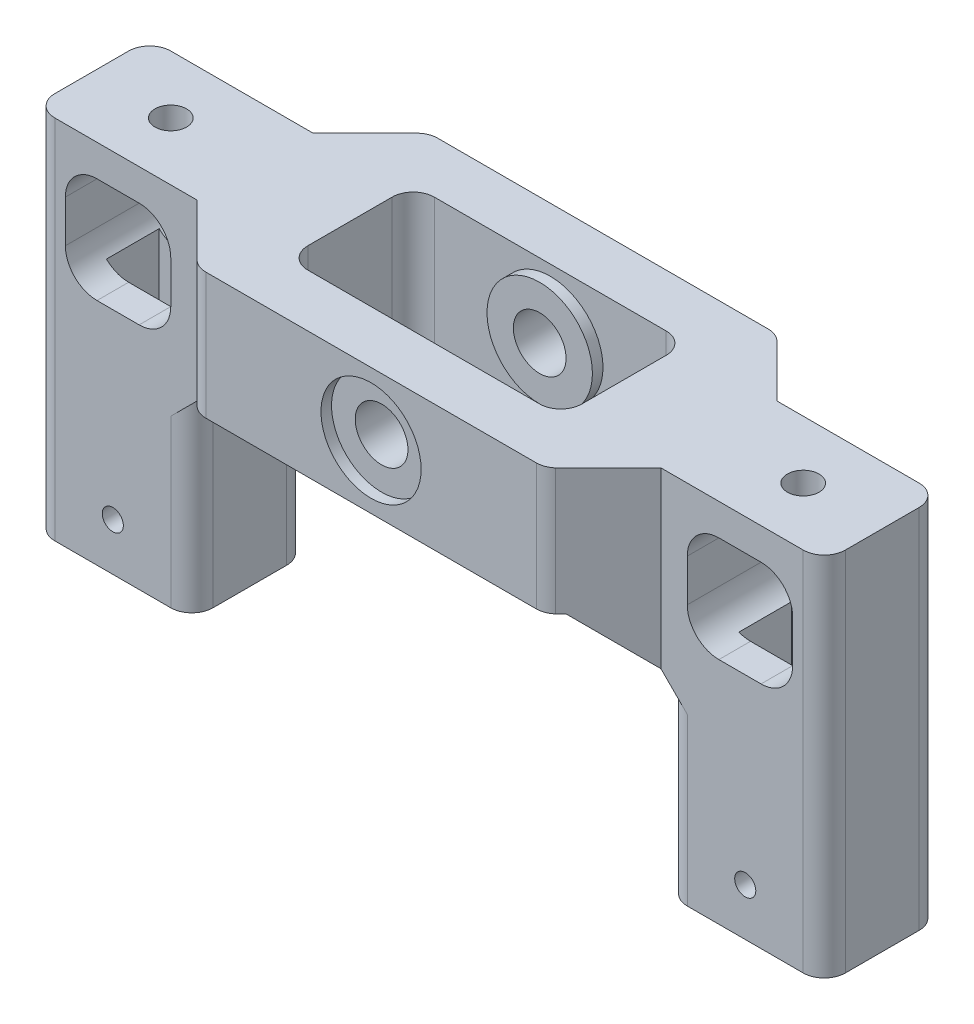
from build123d import *

# Parameters (mm, degrees)
EXTRUDE_1_DEPTH        = 5.5
EXTRUDE_1_DEPTH_BACK   = 5.5
SKETCH_1_W             = 15
SKETCH_1_H             = 24.5
EXTRUDE_1_2_DEPTH      = 5.5
EXTRUDE_1_2_DEPTH_BACK = 5.5
SKETCH_2_W             = 7.2
SKETCH_2_H             = 5
CUT_EXTRUDE_1_DEPTH    = 62
SKETCH_3_W             = 26
SKETCH_3_H             = 12
EXTRUDE_2_DEPTH        = 12
SKETCH_4_R             = 2.5
CUT_EXTRUDE_2_DEPTH    = 90
CHAMFER_2_SIZE         = 5
FILLET_2_R             = 2
SKETCH_14_W            = 15
SKETCH_14_H            = 11
SKETCH_14_W_2          = 7.2
SKETCH_14_H_2          = 5
EXTRUDE_5_DEPTH        = 10.25
SKETCH_7_R             = 1
CUT_EXTRUDE_3_DEPTH    = 34
EXTRUDE_START          = 1
SKETCH_13_R            = 5
SKETCH_13_R_2          = 2.5
EXTRUDE_4_DEPTH        = 1
CHAMFER_3_SIZE         = 5
SKETCH_19_W            = 10
SKETCH_19_H            = 10
CUT_EXTRUDE_4_DEPTH    = 31.2
SKETCH_17_R            = 4.75
SKETCH_17_R_2          = 2.5
CUT_EXTRUDE_5_DEPTH    = 1
SKETCH_20_W            = 7.2
SKETCH_20_H            = 3
EXTRUDE_6_DEPTH        = 5
FILLET_6_R             = 3
FILLET_7_R             = 2
SKETCH_23_R            = 1.5
CUT_EXTRUDE_6_DEPTH    = 3


with BuildPart() as part:
    # 草图1 → 凸台-拉伸1 (new, two sides: drawn at the far end of the back side and taken through both)
    with BuildSketch(Plane.XY.offset(-EXTRUDE_1_DEPTH_BACK)):
        with Locations((30, 0)):
            Rectangle(SKETCH_1_W, SKETCH_1_H)
    extrude(amount=EXTRUDE_1_DEPTH + EXTRUDE_1_DEPTH_BACK)


with BuildPart() as body_2:
    # 草图1 → Extrude 1 2 (new, two sides: drawn at the far end of the back side and taken through both)
    with BuildSketch(Plane.XY.offset(-EXTRUDE_1_2_DEPTH_BACK)):
        with Locations((-30, 0)):
            Rectangle(SKETCH_1_W, SKETCH_1_H)
    extrude(amount=EXTRUDE_1_2_DEPTH + EXTRUDE_1_2_DEPTH_BACK)


with BuildPart() as cut_extrude_1_tool:
    # 草图2 → 切除-拉伸1 (new body)
    with BuildSketch(Plane(origin=(0, 12.25, 0), x_dir=(1, 0, 0), z_dir=(0, 1, 0))):
        with Locations((30, 0)):
            Rectangle(SKETCH_2_W, SKETCH_2_H)
        with Locations((-30, 0)):
            Rectangle(SKETCH_2_W, SKETCH_2_H)
    extrude(amount=-CUT_EXTRUDE_1_DEPTH)


with BuildPart() as part_1:
    add(part.part)

    # 切除-拉伸1: cut by cut_extrude_1_tool
    add(cut_extrude_1_tool.part, mode=Mode.SUBTRACT)



with BuildPart() as body_2_1:
    add(body_2.part)

    # 切除-拉伸1: cut by cut_extrude_1_tool
    add(cut_extrude_1_tool.part, mode=Mode.SUBTRACT)


with BuildPart() as part_2:
    add(part_1.part)

    add(body_2_1.part)  # 凸台-拉伸2 merges body 2
    # 草图3 → 凸台-拉伸2 (add)
    with BuildSketch(Plane(origin=(0, 12.25, 0), x_dir=(1, 0, 0), z_dir=(0, 1, 0))):
        Polygon((22.5, 5.5), (17, 5.5), (17, 11), (-17, 11), (-17, 5.5), (-22.5, 5.5), (-22.5, -5.5), (-17, -5.5), (-17, -11), (17, -11), (17, -5.5), (22.5, -5.5), align=None)
        Rectangle(SKETCH_3_W, SKETCH_3_H, mode=Mode.SUBTRACT)
    extrude(amount=-EXTRUDE_2_DEPTH)

    # 草图4 → 切除-拉伸2 (cut)
    with BuildSketch(Plane.XY.offset(11)):
        with Locations((0, 6.25)):
            Circle(SKETCH_4_R)
    extrude(amount=-CUT_EXTRUDE_2_DEPTH, mode=Mode.SUBTRACT)

    # 倒角2
    chamfer_2_edges = [part_2.edges().sort_by_distance(p)[0] for p in [
        (17, 6.25, 5.5),
        (-17, 6.25, 5.5),
        (-17, 6.25, -5.5),
        (17, 6.25, -5.5),
    ]]
    chamfer(chamfer_2_edges, length=CHAMFER_2_SIZE)

    # 圆角2
    # the kernel refuses this fillet: 2 mm, written as the material it adds along each edge
    with BuildSketch(Plane(origin=(-13, 12.25, 6), x_dir=(0, 0, -1), z_dir=(0, -1, 0)), Plane(origin=(13, 12.25, 6), x_dir=(-1, 0, 0), z_dir=(0, -1, 0)), Plane(origin=(13, 12.25, -6), x_dir=(0, 0, 1), z_dir=(0, -1, 0))) as fillet_2_piece_1:
        with BuildLine():
            CenterArc((FILLET_2_R, FILLET_2_R), FILLET_2_R, 180, 90)
            Line((0, FILLET_2_R), (0, 0))
            Line((0, 0), (FILLET_2_R, 0))
        make_face()
    extrude(amount=12)
    with BuildSketch(Plane(origin=(-13, 12.25, -6), x_dir=(0, 0, 1), z_dir=(0, -1, 0))) as fillet_2_piece_2:
        with BuildLine():
            CenterArc((FILLET_2_R, -FILLET_2_R), FILLET_2_R, 90, 90)
            Line((0, -FILLET_2_R), (0, 0))
            Line((0, 0), (FILLET_2_R, 0))
        make_face()
    extrude(amount=12)
    # the kernel refuses this fillet: 2 mm, written as the material it takes off along each edge
    with BuildSketch(Plane(origin=(17, 15.557189139, 11), x_dir=(0, 0, -1), z_dir=(0, -1, 0))) as fillet_2_2_piece_1:
        with BuildLine():
            CenterArc((2, -1.322875656), FILLET_2_R, 138.590377891, 41.409622109)
            Line((0, -1.322875656), (0, 0))
            Line((0, 0), (0.5, 0))
        make_face()
    extrude(amount=18.614378278, mode=Mode.SUBTRACT)
    with BuildSketch(Plane(origin=(-17, 15.557189139, 11), x_dir=(1, 0, 0), z_dir=(0, -1, 0))) as fillet_2_2_piece_2:
        with BuildLine():
            CenterArc((1.322875656, -2), FILLET_2_R, 90, 41.409622109)
            Line((0, -0.5), (0, 0))
            Line((0, 0), (1.322875656, 0))
        make_face()
    extrude(amount=18.614378278, mode=Mode.SUBTRACT)
    with BuildSketch(Plane(origin=(-17, 15.557189139, -11), x_dir=(1, 0, 0), z_dir=(0, -1, 0))) as fillet_2_2_piece_3:
        with BuildLine():
            CenterArc((1.322875656, 2), FILLET_2_R, 228.590377891, 41.409622109)
            Line((0, 0.5), (0, 0))
            Line((0, 0), (1.322875656, 0))
        make_face()
    extrude(amount=18.614378278, mode=Mode.SUBTRACT)
    with BuildSketch(Plane(origin=(17, 15.557189139, -11), x_dir=(0, 0, 1), z_dir=(0, -1, 0))) as fillet_2_2_piece_4:
        with BuildLine():
            CenterArc((2, 1.322875656), FILLET_2_R, 180, 41.409622109)
            Line((0, 1.322875656), (0, 0))
            Line((0, 0), (0.5, 0))
        make_face()
    extrude(amount=18.614378278, mode=Mode.SUBTRACT)

    # 草图14 → 凸台-拉伸5 (add)
    # profile 1 of 2: a face of its own
    with BuildSketch(Plane.XZ.offset(12.25)):
        with Locations((-30, 0)):
            Rectangle(SKETCH_14_W, SKETCH_14_H)
        with Locations((-30, 0)):
            Rectangle(SKETCH_14_W_2, SKETCH_14_H_2, mode=Mode.SUBTRACT)
    # profile 2 of 2: a face of its own
    with BuildSketch(Plane.XZ.offset(12.25)):
        with Locations((30, 0)):
            Rectangle(SKETCH_14_W, SKETCH_14_H)
        with Locations((30, 0)):
            Rectangle(SKETCH_14_W_2, SKETCH_14_H_2, mode=Mode.SUBTRACT)
    extrude(amount=EXTRUDE_5_DEPTH)

    # 草图7 → 切除-拉伸3 (cut)
    with BuildSketch(Plane.XY.offset(5.5)):
        with Locations(Location((30, -18, 0), (0, 0, 180))):
            Circle(SKETCH_7_R)
        with Locations(Location((-30, -18, 0), (0, 0, 180))):
            Circle(SKETCH_7_R)
    extrude(amount=-CUT_EXTRUDE_3_DEPTH, mode=Mode.SUBTRACT)

    # 草图13 → 凸台-拉伸4 (add)
    with BuildSketch(Plane.XY.offset(-6).offset(EXTRUDE_START)):
        with Locations(Location((0, 6.25, 0), (0, 0, 180))):
            Circle(SKETCH_13_R)
        with Locations((0, 6.25)):
            Circle(SKETCH_13_R_2, mode=Mode.SUBTRACT)
    extrude_4 = extrude(amount=-EXTRUDE_4_DEPTH)

    # 镜向1: 凸台-拉伸4 across plane
    add(extrude_4.mirror(Plane.XY))

    # 倒角3
    chamfer_3_edges = [part_2.edges().sort_by_distance(p)[0] for p in [
        (22.5, 0.25, 0),
        (-22.5, 0.25, 0),
    ]]
    chamfer(chamfer_3_edges, length=CHAMFER_3_SIZE)

    # 草图19 → 切除-拉伸4 (cut)
    with BuildSketch(Plane.XY.offset(5.5)):
        with Locations((-29.5, 4.25)):
            Rectangle(SKETCH_19_W, SKETCH_19_H)
        with Locations((29.5, 4.25)):
            Rectangle(SKETCH_19_W, SKETCH_19_H)
    extrude(amount=-CUT_EXTRUDE_4_DEPTH, mode=Mode.SUBTRACT)

    # 草图17 → 切除-拉伸5 (cut)
    with BuildSketch(Plane.XY.offset(11)):
        with Locations((0, 6.25)):
            Circle(SKETCH_17_R)
        with Locations((0, 6.25)):
            Circle(SKETCH_17_R_2, mode=Mode.SUBTRACT)
    cut_extrude_5 = extrude(amount=-CUT_EXTRUDE_5_DEPTH, mode=Mode.SUBTRACT)

    # 镜向2: 切除-拉伸5 across plane
    add(cut_extrude_5.mirror(Plane.XY), mode=Mode.SUBTRACT)

    # 草图20 → 凸台-拉伸6 (add)
    with BuildSketch(Plane.XY.offset(-2.5)):
        with Locations((-30, 10.75)):
            Rectangle(SKETCH_20_W, SKETCH_20_H)
        with Locations((30, 10.75)):
            Rectangle(SKETCH_20_W, SKETCH_20_H)
    extrude(amount=EXTRUDE_6_DEPTH)

    # 圆角6
    # the kernel refuses this fillet: 3 mm, written as the material it adds along each edge
    with BuildSketch(Plane(origin=(24.5, -0.75, 5.5), x_dir=(0, 1, 0), z_dir=(0, 0, -1))) as fillet_6_piece_1_section:
        with BuildLine():
            CenterArc((FILLET_6_R, FILLET_6_R), FILLET_6_R, 180, 90)
            Line((0, FILLET_6_R), (0, 0))
            Line((0, 0), (FILLET_6_R, 0))
        make_face()
    fillet_6_piece_1 = extrude(amount=11, mode=Mode.PRIVATE)
    fillet_6_piece_1 = split(fillet_6_piece_1, bisect_by=Plane(origin=(24.5, -0.75, 2.5), z_dir=(0, 0, 1)), keep=Keep.TOP, mode=Mode.PRIVATE)
    fillet_6_piece_1 = split(fillet_6_piece_1, bisect_by=Plane(origin=(26.4, -0.75, 5.5), z_dir=(-1, 0, 0)), keep=Keep.TOP, mode=Mode.PRIVATE)
    add(fillet_6_piece_1)
    with BuildSketch(Plane(origin=(24.5, -0.75, 5.5), x_dir=(0, 1, 0), z_dir=(0, 0, -1))) as fillet_6_piece_2_section:
        with BuildLine():
            CenterArc((FILLET_6_R, FILLET_6_R), FILLET_6_R, 180, 90)
            Line((0, FILLET_6_R), (0, 0))
            Line((0, 0), (FILLET_6_R, 0))
        make_face()
    fillet_6_piece_2 = extrude(amount=11, mode=Mode.PRIVATE)
    fillet_6_piece_2 = split(fillet_6_piece_2, bisect_by=Plane(origin=(24.5, -0.75, 2.5), z_dir=(0, 0, 1)), keep=Keep.TOP, mode=Mode.PRIVATE)
    fillet_6_piece_2 = split(fillet_6_piece_2, bisect_by=Plane(origin=(26.4, -0.75, 5.5), z_dir=(1, 0, 0)), keep=Keep.TOP, mode=Mode.PRIVATE)
    add(fillet_6_piece_2)
    with BuildSketch(Plane(origin=(24.5, -0.75, 5.5), x_dir=(0, 1, 0), z_dir=(0, 0, -1))) as fillet_6_piece_3_section:
        with BuildLine():
            CenterArc((FILLET_6_R, FILLET_6_R), FILLET_6_R, 180, 90)
            Line((0, FILLET_6_R), (0, 0))
            Line((0, 0), (FILLET_6_R, 0))
        make_face()
    fillet_6_piece_3 = extrude(amount=11, mode=Mode.PRIVATE)
    fillet_6_piece_3 = split(fillet_6_piece_3, bisect_by=Plane(origin=(24.5, -0.75, -2.5), z_dir=(0, 0, 1)), keep=Keep.TOP, mode=Mode.PRIVATE)
    fillet_6_piece_3 = split(fillet_6_piece_3, bisect_by=Plane(origin=(24.5, -0.75, 2.5), z_dir=(0, 0, -1)), keep=Keep.TOP, mode=Mode.PRIVATE)
    fillet_6_piece_3 = split(fillet_6_piece_3, bisect_by=Plane(origin=(26.4, -0.75, 5.5), z_dir=(-1, 0, 0)), keep=Keep.TOP, mode=Mode.PRIVATE)
    add(fillet_6_piece_3)
    with BuildSketch(Plane(origin=(24.5, -0.75, 5.5), x_dir=(0, 1, 0), z_dir=(0, 0, -1))) as fillet_6_piece_4_section:
        with BuildLine():
            CenterArc((FILLET_6_R, FILLET_6_R), FILLET_6_R, 180, 90)
            Line((0, FILLET_6_R), (0, 0))
            Line((0, 0), (FILLET_6_R, 0))
        make_face()
    fillet_6_piece_4 = extrude(amount=11, mode=Mode.PRIVATE)
    fillet_6_piece_4 = split(fillet_6_piece_4, bisect_by=Plane(origin=(24.5, -0.75, -2.5), z_dir=(0, 0, -1)), keep=Keep.TOP, mode=Mode.PRIVATE)
    fillet_6_piece_4 = split(fillet_6_piece_4, bisect_by=Plane(origin=(26.4, -0.75, 5.5), z_dir=(-1, 0, 0)), keep=Keep.TOP, mode=Mode.PRIVATE)
    add(fillet_6_piece_4)
    with BuildSketch(Plane(origin=(24.5, -0.75, 5.5), x_dir=(0, 1, 0), z_dir=(0, 0, -1))) as fillet_6_piece_5_section:
        with BuildLine():
            CenterArc((FILLET_6_R, FILLET_6_R), FILLET_6_R, 180, 90)
            Line((0, FILLET_6_R), (0, 0))
            Line((0, 0), (FILLET_6_R, 0))
        make_face()
    fillet_6_piece_5 = extrude(amount=11, mode=Mode.PRIVATE)
    fillet_6_piece_5 = split(fillet_6_piece_5, bisect_by=Plane(origin=(24.5, -0.75, -2.5), z_dir=(0, 0, -1)), keep=Keep.TOP, mode=Mode.PRIVATE)
    fillet_6_piece_5 = split(fillet_6_piece_5, bisect_by=Plane(origin=(26.4, -0.75, 5.5), z_dir=(1, 0, 0)), keep=Keep.TOP, mode=Mode.PRIVATE)
    add(fillet_6_piece_5)
    with BuildSketch(Plane(origin=(-24.5, -0.75, 5.5), x_dir=(-1, 0, 0), z_dir=(0, 0, -1))) as fillet_6_piece_6_section:
        with BuildLine():
            CenterArc((FILLET_6_R, FILLET_6_R), FILLET_6_R, 180, 90)
            Line((0, FILLET_6_R), (0, 0))
            Line((0, 0), (FILLET_6_R, 0))
        make_face()
    fillet_6_piece_6 = extrude(amount=11, mode=Mode.PRIVATE)
    fillet_6_piece_6 = split(fillet_6_piece_6, bisect_by=Plane(origin=(-24.5, -0.75, 2.5), z_dir=(0, 0, 1)), keep=Keep.TOP, mode=Mode.PRIVATE)
    fillet_6_piece_6 = split(fillet_6_piece_6, bisect_by=Plane(origin=(-26.4, -0.75, 5.5), z_dir=(-1, 0, 0)), keep=Keep.TOP, mode=Mode.PRIVATE)
    add(fillet_6_piece_6)
    with BuildSketch(Plane(origin=(-24.5, -0.75, 5.5), x_dir=(-1, 0, 0), z_dir=(0, 0, -1))) as fillet_6_piece_7_section:
        with BuildLine():
            CenterArc((FILLET_6_R, FILLET_6_R), FILLET_6_R, 180, 90)
            Line((0, FILLET_6_R), (0, 0))
            Line((0, 0), (FILLET_6_R, 0))
        make_face()
    fillet_6_piece_7 = extrude(amount=11, mode=Mode.PRIVATE)
    fillet_6_piece_7 = split(fillet_6_piece_7, bisect_by=Plane(origin=(-24.5, -0.75, 2.5), z_dir=(0, 0, 1)), keep=Keep.TOP, mode=Mode.PRIVATE)
    fillet_6_piece_7 = split(fillet_6_piece_7, bisect_by=Plane(origin=(-26.4, -0.75, 5.5), z_dir=(1, 0, 0)), keep=Keep.TOP, mode=Mode.PRIVATE)
    add(fillet_6_piece_7)
    with BuildSketch(Plane(origin=(-24.5, -0.75, 5.5), x_dir=(-1, 0, 0), z_dir=(0, 0, -1))) as fillet_6_piece_8_section:
        with BuildLine():
            CenterArc((FILLET_6_R, FILLET_6_R), FILLET_6_R, 180, 90)
            Line((0, FILLET_6_R), (0, 0))
            Line((0, 0), (FILLET_6_R, 0))
        make_face()
    fillet_6_piece_8 = extrude(amount=11, mode=Mode.PRIVATE)
    fillet_6_piece_8 = split(fillet_6_piece_8, bisect_by=Plane(origin=(-24.5, -0.75, 2.5), z_dir=(0, 0, -1)), keep=Keep.TOP, mode=Mode.PRIVATE)
    fillet_6_piece_8 = split(fillet_6_piece_8, bisect_by=Plane(origin=(-24.5, -0.75, -2.5), z_dir=(0, 0, 1)), keep=Keep.TOP, mode=Mode.PRIVATE)
    fillet_6_piece_8 = split(fillet_6_piece_8, bisect_by=Plane(origin=(-26.4, -0.75, 5.5), z_dir=(1, 0, 0)), keep=Keep.TOP, mode=Mode.PRIVATE)
    add(fillet_6_piece_8)
    with BuildSketch(Plane(origin=(-24.5, -0.75, 5.5), x_dir=(-1, 0, 0), z_dir=(0, 0, -1))) as fillet_6_piece_9_section:
        with BuildLine():
            CenterArc((FILLET_6_R, FILLET_6_R), FILLET_6_R, 180, 90)
            Line((0, FILLET_6_R), (0, 0))
            Line((0, 0), (FILLET_6_R, 0))
        make_face()
    fillet_6_piece_9 = extrude(amount=11, mode=Mode.PRIVATE)
    fillet_6_piece_9 = split(fillet_6_piece_9, bisect_by=Plane(origin=(-24.5, -0.75, -2.5), z_dir=(0, 0, -1)), keep=Keep.TOP, mode=Mode.PRIVATE)
    fillet_6_piece_9 = split(fillet_6_piece_9, bisect_by=Plane(origin=(-26.4, -0.75, 5.5), z_dir=(-1, 0, 0)), keep=Keep.TOP, mode=Mode.PRIVATE)
    add(fillet_6_piece_9)
    with BuildSketch(Plane(origin=(-24.5, -0.75, 5.5), x_dir=(-1, 0, 0), z_dir=(0, 0, -1))) as fillet_6_piece_10_section:
        with BuildLine():
            CenterArc((FILLET_6_R, FILLET_6_R), FILLET_6_R, 180, 90)
            Line((0, FILLET_6_R), (0, 0))
            Line((0, 0), (FILLET_6_R, 0))
        make_face()
    fillet_6_piece_10 = extrude(amount=11, mode=Mode.PRIVATE)
    fillet_6_piece_10 = split(fillet_6_piece_10, bisect_by=Plane(origin=(-24.5, -0.75, -2.5), z_dir=(0, 0, -1)), keep=Keep.TOP, mode=Mode.PRIVATE)
    fillet_6_piece_10 = split(fillet_6_piece_10, bisect_by=Plane(origin=(-26.4, -0.75, 5.5), z_dir=(1, 0, 0)), keep=Keep.TOP, mode=Mode.PRIVATE)
    add(fillet_6_piece_10)
    with BuildSketch(Plane(origin=(34.5, -0.75, 5.5), x_dir=(-1, 0, 0), z_dir=(0, 0, -1))) as fillet_6_piece_11_section:
        with BuildLine():
            CenterArc((FILLET_6_R, FILLET_6_R), FILLET_6_R, 180, 90)
            Line((0, FILLET_6_R), (0, 0))
            Line((0, 0), (FILLET_6_R, 0))
        make_face()
    fillet_6_piece_11 = extrude(amount=11, mode=Mode.PRIVATE)
    fillet_6_piece_11 = split(fillet_6_piece_11, bisect_by=Plane(origin=(33.6, -0.75, 5.5), z_dir=(-1, 0, 0)), keep=Keep.TOP, mode=Mode.PRIVATE)
    fillet_6_piece_11 = split(fillet_6_piece_11, bisect_by=Plane(origin=(34.5, -0.75, 2.5), z_dir=(0, 0, 1)), keep=Keep.TOP, mode=Mode.PRIVATE)
    add(fillet_6_piece_11)
    with BuildSketch(Plane(origin=(34.5, -0.75, 5.5), x_dir=(-1, 0, 0), z_dir=(0, 0, -1))) as fillet_6_piece_12_section:
        with BuildLine():
            CenterArc((FILLET_6_R, FILLET_6_R), FILLET_6_R, 180, 90)
            Line((0, FILLET_6_R), (0, 0))
            Line((0, 0), (FILLET_6_R, 0))
        make_face()
    fillet_6_piece_12 = extrude(amount=11, mode=Mode.PRIVATE)
    fillet_6_piece_12 = split(fillet_6_piece_12, bisect_by=Plane(origin=(33.6, -0.75, 5.5), z_dir=(1, 0, 0)), keep=Keep.TOP, mode=Mode.PRIVATE)
    fillet_6_piece_12 = split(fillet_6_piece_12, bisect_by=Plane(origin=(34.5, -0.75, 2.5), z_dir=(0, 0, 1)), keep=Keep.TOP, mode=Mode.PRIVATE)
    add(fillet_6_piece_12)
    with BuildSketch(Plane(origin=(34.5, -0.75, 5.5), x_dir=(-1, 0, 0), z_dir=(0, 0, -1))) as fillet_6_piece_13_section:
        with BuildLine():
            CenterArc((FILLET_6_R, FILLET_6_R), FILLET_6_R, 180, 90)
            Line((0, FILLET_6_R), (0, 0))
            Line((0, 0), (FILLET_6_R, 0))
        make_face()
    fillet_6_piece_13 = extrude(amount=11, mode=Mode.PRIVATE)
    fillet_6_piece_13 = split(fillet_6_piece_13, bisect_by=Plane(origin=(34.5, -0.75, -2.5), z_dir=(0, 0, 1)), keep=Keep.TOP, mode=Mode.PRIVATE)
    fillet_6_piece_13 = split(fillet_6_piece_13, bisect_by=Plane(origin=(33.6, -0.75, 5.5), z_dir=(1, 0, 0)), keep=Keep.TOP, mode=Mode.PRIVATE)
    fillet_6_piece_13 = split(fillet_6_piece_13, bisect_by=Plane(origin=(34.5, -0.75, 2.5), z_dir=(0, 0, -1)), keep=Keep.TOP, mode=Mode.PRIVATE)
    add(fillet_6_piece_13)
    with BuildSketch(Plane(origin=(34.5, -0.75, 5.5), x_dir=(-1, 0, 0), z_dir=(0, 0, -1))) as fillet_6_piece_14_section:
        with BuildLine():
            CenterArc((FILLET_6_R, FILLET_6_R), FILLET_6_R, 180, 90)
            Line((0, FILLET_6_R), (0, 0))
            Line((0, 0), (FILLET_6_R, 0))
        make_face()
    fillet_6_piece_14 = extrude(amount=11, mode=Mode.PRIVATE)
    fillet_6_piece_14 = split(fillet_6_piece_14, bisect_by=Plane(origin=(34.5, -0.75, -2.5), z_dir=(0, 0, -1)), keep=Keep.TOP, mode=Mode.PRIVATE)
    fillet_6_piece_14 = split(fillet_6_piece_14, bisect_by=Plane(origin=(33.6, -0.75, 5.5), z_dir=(-1, 0, 0)), keep=Keep.TOP, mode=Mode.PRIVATE)
    add(fillet_6_piece_14)
    with BuildSketch(Plane(origin=(34.5, -0.75, 5.5), x_dir=(-1, 0, 0), z_dir=(0, 0, -1))) as fillet_6_piece_15_section:
        with BuildLine():
            CenterArc((FILLET_6_R, FILLET_6_R), FILLET_6_R, 180, 90)
            Line((0, FILLET_6_R), (0, 0))
            Line((0, 0), (FILLET_6_R, 0))
        make_face()
    fillet_6_piece_15 = extrude(amount=11, mode=Mode.PRIVATE)
    fillet_6_piece_15 = split(fillet_6_piece_15, bisect_by=Plane(origin=(34.5, -0.75, -2.5), z_dir=(0, 0, -1)), keep=Keep.TOP, mode=Mode.PRIVATE)
    fillet_6_piece_15 = split(fillet_6_piece_15, bisect_by=Plane(origin=(33.6, -0.75, 5.5), z_dir=(1, 0, 0)), keep=Keep.TOP, mode=Mode.PRIVATE)
    add(fillet_6_piece_15)
    with BuildSketch(Plane(origin=(24.5, 9.25, 5.5), x_dir=(1, 0, 0), z_dir=(0, 0, -1)), Plane(origin=(-24.5, 9.25, 5.5), x_dir=(0, -1, 0), z_dir=(0, 0, -1)), Plane(origin=(-34.5, 9.25, 5.5), x_dir=(1, 0, 0), z_dir=(0, 0, -1))) as fillet_6_piece_16:
        with BuildLine():
            CenterArc((FILLET_6_R, FILLET_6_R), FILLET_6_R, 180, 90)
            Line((0, FILLET_6_R), (0, 0))
            Line((0, 0), (FILLET_6_R, 0))
        make_face()
    extrude(amount=11)
    with BuildSketch(Plane(origin=(34.5, 9.25, 5.5), x_dir=(-1, 0, 0), z_dir=(0, 0, -1))) as fillet_6_piece_17:
        with BuildLine():
            CenterArc((FILLET_6_R, -FILLET_6_R), FILLET_6_R, 90, 90)
            Line((0, -FILLET_6_R), (0, 0))
            Line((0, 0), (FILLET_6_R, 0))
        make_face()
    extrude(amount=11)
    with BuildSketch(Plane(origin=(-34.5, -0.75, 5.5), x_dir=(1, 0, 0), z_dir=(0, 0, -1))) as fillet_6_piece_18_section:
        with BuildLine():
            CenterArc((FILLET_6_R, -FILLET_6_R), FILLET_6_R, 90, 90)
            Line((0, -FILLET_6_R), (0, 0))
            Line((0, 0), (FILLET_6_R, 0))
        make_face()
    fillet_6_piece_18 = extrude(amount=11, mode=Mode.PRIVATE)
    fillet_6_piece_18 = split(fillet_6_piece_18, bisect_by=Plane(origin=(-34.5, -0.75, 2.5), z_dir=(0, 0, 1)), keep=Keep.TOP, mode=Mode.PRIVATE)
    fillet_6_piece_18 = split(fillet_6_piece_18, bisect_by=Plane(origin=(-33.6, -0.75, 5.5), z_dir=(1, 0, 0)), keep=Keep.TOP, mode=Mode.PRIVATE)
    add(fillet_6_piece_18)
    with BuildSketch(Plane(origin=(-34.5, -0.75, 5.5), x_dir=(1, 0, 0), z_dir=(0, 0, -1))) as fillet_6_piece_19_section:
        with BuildLine():
            CenterArc((FILLET_6_R, -FILLET_6_R), FILLET_6_R, 90, 90)
            Line((0, -FILLET_6_R), (0, 0))
            Line((0, 0), (FILLET_6_R, 0))
        make_face()
    fillet_6_piece_19 = extrude(amount=11, mode=Mode.PRIVATE)
    fillet_6_piece_19 = split(fillet_6_piece_19, bisect_by=Plane(origin=(-34.5, -0.75, 2.5), z_dir=(0, 0, 1)), keep=Keep.TOP, mode=Mode.PRIVATE)
    fillet_6_piece_19 = split(fillet_6_piece_19, bisect_by=Plane(origin=(-33.6, -0.75, 5.5), z_dir=(-1, 0, 0)), keep=Keep.TOP, mode=Mode.PRIVATE)
    add(fillet_6_piece_19)
    with BuildSketch(Plane(origin=(-34.5, -0.75, 5.5), x_dir=(1, 0, 0), z_dir=(0, 0, -1))) as fillet_6_piece_20_section:
        with BuildLine():
            CenterArc((FILLET_6_R, -FILLET_6_R), FILLET_6_R, 90, 90)
            Line((0, -FILLET_6_R), (0, 0))
            Line((0, 0), (FILLET_6_R, 0))
        make_face()
    fillet_6_piece_20 = extrude(amount=11, mode=Mode.PRIVATE)
    fillet_6_piece_20 = split(fillet_6_piece_20, bisect_by=Plane(origin=(-34.5, -0.75, 2.5), z_dir=(0, 0, -1)), keep=Keep.TOP, mode=Mode.PRIVATE)
    fillet_6_piece_20 = split(fillet_6_piece_20, bisect_by=Plane(origin=(-33.6, -0.75, 5.5), z_dir=(-1, 0, 0)), keep=Keep.TOP, mode=Mode.PRIVATE)
    fillet_6_piece_20 = split(fillet_6_piece_20, bisect_by=Plane(origin=(-34.5, -0.75, -2.5), z_dir=(0, 0, 1)), keep=Keep.TOP, mode=Mode.PRIVATE)
    add(fillet_6_piece_20)
    with BuildSketch(Plane(origin=(-34.5, -0.75, 5.5), x_dir=(1, 0, 0), z_dir=(0, 0, -1))) as fillet_6_piece_21_section:
        with BuildLine():
            CenterArc((FILLET_6_R, -FILLET_6_R), FILLET_6_R, 90, 90)
            Line((0, -FILLET_6_R), (0, 0))
            Line((0, 0), (FILLET_6_R, 0))
        make_face()
    fillet_6_piece_21 = extrude(amount=11, mode=Mode.PRIVATE)
    fillet_6_piece_21 = split(fillet_6_piece_21, bisect_by=Plane(origin=(-33.6, -0.75, 5.5), z_dir=(1, 0, 0)), keep=Keep.TOP, mode=Mode.PRIVATE)
    fillet_6_piece_21 = split(fillet_6_piece_21, bisect_by=Plane(origin=(-34.5, -0.75, -2.5), z_dir=(0, 0, -1)), keep=Keep.TOP, mode=Mode.PRIVATE)
    add(fillet_6_piece_21)
    with BuildSketch(Plane(origin=(-34.5, -0.75, 5.5), x_dir=(1, 0, 0), z_dir=(0, 0, -1))) as fillet_6_piece_22_section:
        with BuildLine():
            CenterArc((FILLET_6_R, -FILLET_6_R), FILLET_6_R, 90, 90)
            Line((0, -FILLET_6_R), (0, 0))
            Line((0, 0), (FILLET_6_R, 0))
        make_face()
    fillet_6_piece_22 = extrude(amount=11, mode=Mode.PRIVATE)
    fillet_6_piece_22 = split(fillet_6_piece_22, bisect_by=Plane(origin=(-33.6, -0.75, 5.5), z_dir=(-1, 0, 0)), keep=Keep.TOP, mode=Mode.PRIVATE)
    fillet_6_piece_22 = split(fillet_6_piece_22, bisect_by=Plane(origin=(-34.5, -0.75, -2.5), z_dir=(0, 0, -1)), keep=Keep.TOP, mode=Mode.PRIVATE)
    add(fillet_6_piece_22)

    # 圆角7
    fillet_7_edges = [part_2.edges().sort_by_distance(p)[0] for p in [
        (-37.5, -5.125, -5.5),
        (-22.5, -13.625, 5.5),
        (-37.5, -5.125, 5.5),
        (37.5, -5.125, 5.5),
        (22.5, -13.625, 5.5),
        (22.5, -13.625, -5.5),
        (37.5, -5.125, -5.5),
        (-22.5, -13.625, -5.5),
    ]]
    fillet(fillet_7_edges, radius=FILLET_7_R)

    # 草图23 → 切除-拉伸6 (cut)
    with BuildSketch(Plane(origin=(0, 12.25, 0), x_dir=(1, 0, 0), z_dir=(0, 1, 0))):
        with Locations(Location((30, 0, 0), (0, 0, 180))):
            Circle(SKETCH_23_R)
        with Locations(Location((-30, 0, 0), (0, 0, 180))):
            Circle(SKETCH_23_R)
    extrude(amount=-CUT_EXTRUDE_6_DEPTH, mode=Mode.SUBTRACT)


solid = part_2.part
